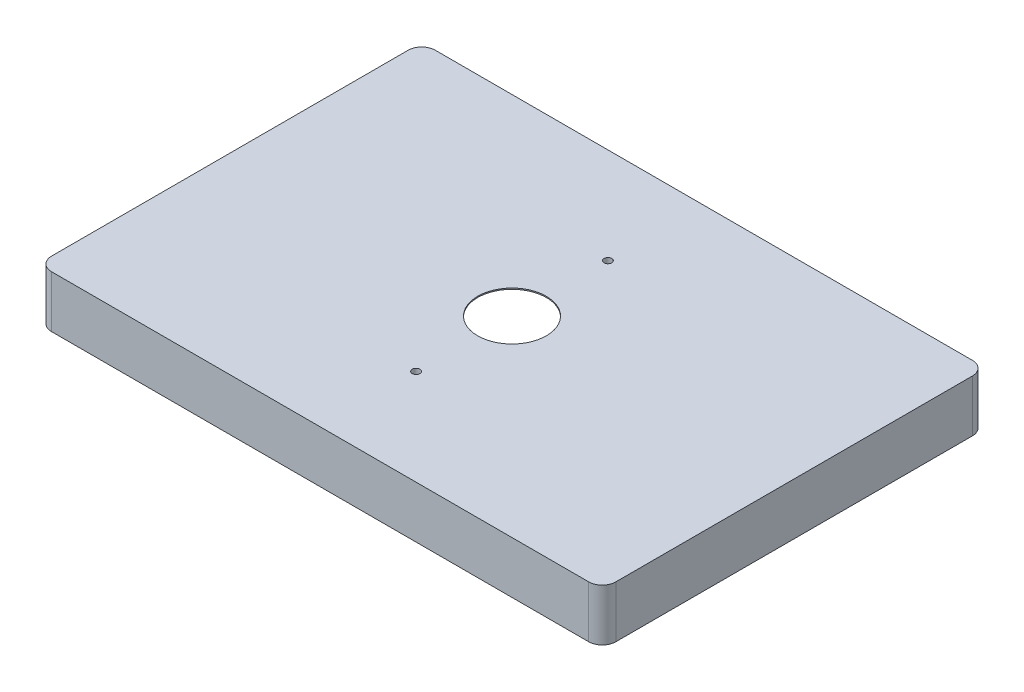
from build123d import *
from OCP.BRepFilletAPI import BRepFilletAPI_MakeChamfer

# Parameters (mm, degrees)
SKETCH1_W                                    = 250
SKETCH1_H                                    = 170
SKETCH1_R                                    = 15.2
BOSS_EXTRUDE1_DEPTH                          = 10
FILLET1_R                                    = 6
BOSS_EXTRUDE2_START                          = 13
BOSS_EXTRUDE2_DEPTH                          = 13
CUT_EXTRUDE1_DEPTH                           = 8
CHAMFER1_SIZE                                = 5
CHAMFER1_SIZE2                               = 1.5
CSK_FOR_M3_HEX_SOCKET_COUNTERSUNK_CA_2_COUNT = 2
CSK_FOR_M3_HEX_SOCKET_COUNTERSUNK_CA_2_PITCH = 85
CHAMFER2_SIZE                                = 8
CHAMFER2_SIZE_2                              = 5
CUT_EXTRUDE2_DEPTH                           = 2
CHAMFER3_SIZE                                = 2
FILLET2_R                                    = 2


# Some blends are built 0.0001 mm under size
with BuildPart() as part:
    # Sketch1 → Boss-Extrude1 (new body)
    with BuildSketch(Plane(origin=(0, 0, 0), x_dir=(1, 0, 0), z_dir=(0, 1, 0))):
        Rectangle(SKETCH1_W, SKETCH1_H)
        with Locations(Location((0, 0, 0), (0, 0, 270))):
            Circle(SKETCH1_R, mode=Mode.SUBTRACT)
    extrude(amount=-BOSS_EXTRUDE1_DEPTH)

    # Fillet1
    fillet1_edges = [part.edges().sort_by_distance(p)[0] for p in [
        (-125, -5, -85),
        (125, -5, -85),
        (125, -5, 85),
        (-125, -5, 85),
    ]]
    fillet(fillet1_edges, radius=FILLET1_R)

    # Sketch3 → Boss-Extrude2 (add)
    with BuildSketch(Plane.XZ.offset(10).offset(BOSS_EXTRUDE2_START)):
        with BuildLine():
            Line((-125, 79), (-125, -79))
            ThreePointArc((-125, -79), (-123.242640687, -83.242640687), (-119, -85))
            Line((-119, -85), (119, -85))
            ThreePointArc((119, -85), (123.242640687, -83.242640687), (125, -79))
            Line((125, -79), (125, 79))
            ThreePointArc((125, 79), (123.242640687, 83.242640687), (119, 85))
            Line((119, 85), (-119, 85))
            ThreePointArc((-119, 85), (-123.242640687, 83.242640687), (-125, 79))
        make_face()
        with BuildLine():
            Line((-121, 79), (-121, -79))
            ThreePointArc((-121, -79), (-120.414213562, -80.414213562), (-119, -81))
            Line((-119, -81), (119, -81))
            ThreePointArc((119, -81), (120.414213562, -80.414213562), (121, -79))
            Line((121, -79), (121, 79))
            ThreePointArc((121, 79), (120.414213562, 80.414213562), (119, 81))
            Line((119, 81), (-119, 81))
            ThreePointArc((-119, 81), (-120.414213562, 80.414213562), (-121, 79))
        make_face(mode=Mode.SUBTRACT)
    extrude(amount=-BOSS_EXTRUDE2_DEPTH)

    # Sketch4 → Cut-Extrude1 (cut)
    with BuildSketch(Plane.XZ.offset(10)):
        with BuildLine():
            Line((121, -50), (121, 50))
            Line((121, 50), (0, 30))
            ThreePointArc((0, 30), (-25.448368938, 0), (0, -30))
            Line((0, -30), (121, -50))
        make_face()
    extrude(amount=-CUT_EXTRUDE1_DEPTH, mode=Mode.SUBTRACT)

    # Chamfer1
    chamfer1_edges = [part.edges().sort_by_distance(p)[0] for p in [
        (0, -2, -15.2),
    ]]
    chamfer1_side = [part.faces().sort_by_distance(p)[0] for p in [
        (61.561292917, -2, 0),
    ]]
    chamfer(chamfer1_edges, length=CHAMFER1_SIZE, length2=CHAMFER1_SIZE2, reference=chamfer1_side[0])

    # Sketch7 → CSK for M3 Hex Socket Countersunk Cap Screw1 (revolve, cut)
    with BuildSketch(Plane(origin=(0, -10, -42.5), x_dir=(0, 0, -1), z_dir=(1, 0, 0))):
        Polygon((0, 0), (0, 10), (1.7, 10), (1.7, 5.66), (3.36, 4), (3.36, 0), align=None)
    csk_for_m3_hex_socket_countersunk_cap_sc = revolve(axis=Axis((0, -16.35, -42.5), (0, 1, 0)), mode=Mode.SUBTRACT)

    # CSK for M3 Hex Socket Countersunk Ca 2: CSK for M3 Hex Socket Countersunk Cap Screw1 ×2
    with Locations(*[(0, 0, i * CSK_FOR_M3_HEX_SOCKET_COUNTERSUNK_CA_2_PITCH) for i in range(1, CSK_FOR_M3_HEX_SOCKET_COUNTERSUNK_CA_2_COUNT)]):
        add(csk_for_m3_hex_socket_countersunk_cap_sc, mode=Mode.SUBTRACT)

    # Chamfer2
    chamfer2_edges_1 = [part.edges().sort_by_distance(p)[0] for p in [
        (60.5, -10, -40),
    ]]
    chamfer2_side_1 = [part.faces().sort_by_distance(p)[0] for p in [
        (60.5, -9.9, -40),
    ]]
    chamfer2_edges_2 = [part.edges().sort_by_distance(p)[0] for p in [
        (-25.448368938, -10, 0),
    ]]
    chamfer2_side_2 = [part.faces().sort_by_distance(p)[0] for p in [
        (-25.448368938, -9.9, 0),
    ]]
    chamfer2_edges_3 = [part.edges().sort_by_distance(p)[0] for p in [
        (60.5, -10, 40),
    ]]
    chamfer2_side_3 = [part.faces().sort_by_distance(p)[0] for p in [
        (60.5, -9.9, 40),
    ]]
    chamfer2 = BRepFilletAPI_MakeChamfer(part.part.solid().wrapped)
    for e in chamfer2_edges_1:
        chamfer2.Add(CHAMFER2_SIZE - 0.0001, CHAMFER2_SIZE_2 - 0.0001, e.wrapped, chamfer2_side_1[0].wrapped)
    for e in chamfer2_edges_2:
        chamfer2.Add(CHAMFER2_SIZE - 0.0001, CHAMFER2_SIZE_2 - 0.0001, e.wrapped, chamfer2_side_2[0].wrapped)
    for e in chamfer2_edges_3:
        chamfer2.Add(CHAMFER2_SIZE - 0.0001, CHAMFER2_SIZE_2 - 0.0001, e.wrapped, chamfer2_side_3[0].wrapped)
    add(Compound.cast(chamfer2.Shape()), mode=Mode.REPLACE)  # a hair under: the kernel refuses the full size

    # Sketch8 → Cut-Extrude2 (cut)
    with BuildSketch(Plane.ZY.offset(-121)):
        Polygon((55.067841104, -10), (50, -2), (-50, -2), (-55.067841104, -10), (-50, -18), (50, -18), align=None)
    extrude(amount=-CUT_EXTRUDE2_DEPTH, mode=Mode.SUBTRACT)

    # Chamfer3
    chamfer3_edges = [part.edges().sort_by_distance(p)[0] for p in [
        (123, -14, -52.533920552),
        (123, -18, 0),
        (123, -14, 52.533920552),
    ]]
    chamfer(chamfer3_edges, length=CHAMFER3_SIZE - 0.0001)  # a hair under: the kernel refuses the full size

    # Fillet2
    # the kernel refuses this fillet: 2 mm, written as the material it adds along each edge
    with BuildSketch(Plane(origin=(119.805291771, -19.194808229, -50.657483625), x_dir=(-0.25641443496762006, 0.6500466420129046, -0.715325800421027), z_dir=(0.6589777215811099, 0.6589777215811111, 0.36262477151945494))) as fillet2_piece_1_section:
        with BuildLine():
            CenterArc((FILLET2_R * 0.362624771519, FILLET2_R), FILLET2_R, 230.136202028, 39.863797972)
            Line((-FILLET2_R * 0.278340002895, FILLET2_R * 0.232429704874), (0, 0))
            Line((0, 0), (FILLET2_R * 0.362624771519, 0))
        make_face()
    fillet2_piece_1 = extrude(amount=6.661099933, mode=Mode.PRIVATE)
    fillet2_piece_1 = split(fillet2_piece_1, bisect_by=Plane(origin=(121, -18.0000375, -50.000020636), z_dir=(1, 0, 0)), keep=Keep.TOP, mode=Mode.PRIVATE)
    add(fillet2_piece_1)
    with BuildSketch(Plane(origin=(124.194808229, -14.805291771, 48.242003783), x_dir=(-0.2564144349676279, -0.25641443496763033, -0.9319352311617277), z_dir=(-0.6589777215811099, -0.658977721581111, 0.3626247715194551))) as fillet2_piece_2_section:
        with BuildLine():
            CenterArc((FILLET2_R * 0.362624771519, -FILLET2_R), FILLET2_R, 90, 39.863797972)
            Line((-FILLET2_R * 0.278340002895, -FILLET2_R * 0.232429704874), (0, 0))
            Line((0, 0), (FILLET2_R * 0.362624771519, 0))
        make_face()
    fillet2_piece_2 = extrude(amount=6.661099933, mode=Mode.PRIVATE)
    fillet2_piece_2 = split(fillet2_piece_2, bisect_by=Plane(origin=(121, -16.865837899, 49.375888958), z_dir=(1, 0, 0)), keep=Keep.TOP, mode=Mode.PRIVATE)
    add(fillet2_piece_2)
    with BuildSketch(Plane(origin=(123, -12.35524068, 56.559839295), x_dir=(0, -0.5351405902517741, -0.8447630133149668), z_dir=(0, 0.844763013314967, -0.5351405902517741))) as fillet2_piece_3_section:
        with BuildLine():
            CenterArc((FILLET2_R, FILLET2_R), FILLET2_R, 180, 90)
            Line((0, FILLET2_R), (0, 0))
            Line((0, 0), (FILLET2_R, 0))
        make_face()
    fillet2_piece_3 = extrude(amount=17.258160593, mode=Mode.PRIVATE)
    fillet2_piece_3 = split(fillet2_piece_3, bisect_by=Plane(origin=(122.545498185, 0, 51.673056741), z_dir=(0, -1, 0)), keep=Keep.TOP, mode=Mode.PRIVATE)
    add(fillet2_piece_3)
    with BuildSketch(Plane(origin=(123, 2.223815067, -47.324297049), x_dir=(-1, 0, 0), z_dir=(0, -0.8447630133149663, -0.5351405902517751))) as fillet2_piece_4_section:
        with BuildLine():
            CenterArc((FILLET2_R, -FILLET2_R), FILLET2_R, 90, 90)
            Line((0, -FILLET2_R), (0, 0))
            Line((0, 0), (FILLET2_R, 0))
        make_face()
    fillet2_piece_4 = extrude(amount=17.258160593, mode=Mode.PRIVATE)
    fillet2_piece_4 = split(fillet2_piece_4, bisect_by=Plane(origin=(122.545498185, 0, -51.67305674), z_dir=(0, -1, 0)), keep=Keep.TOP, mode=Mode.PRIVATE)
    add(fillet2_piece_4)
    with BuildSketch(Plane(origin=(123, -2, 55), x_dir=(0, -1, 0), z_dir=(0, 0, -1))) as fillet2_piece_5:
        with BuildLine():
            CenterArc((FILLET2_R, FILLET2_R), FILLET2_R, 180, 90)
            Line((0, FILLET2_R), (0, 0))
            Line((0, 0), (FILLET2_R, 0))
        make_face()
    extrude(amount=110)


solid = part.part
